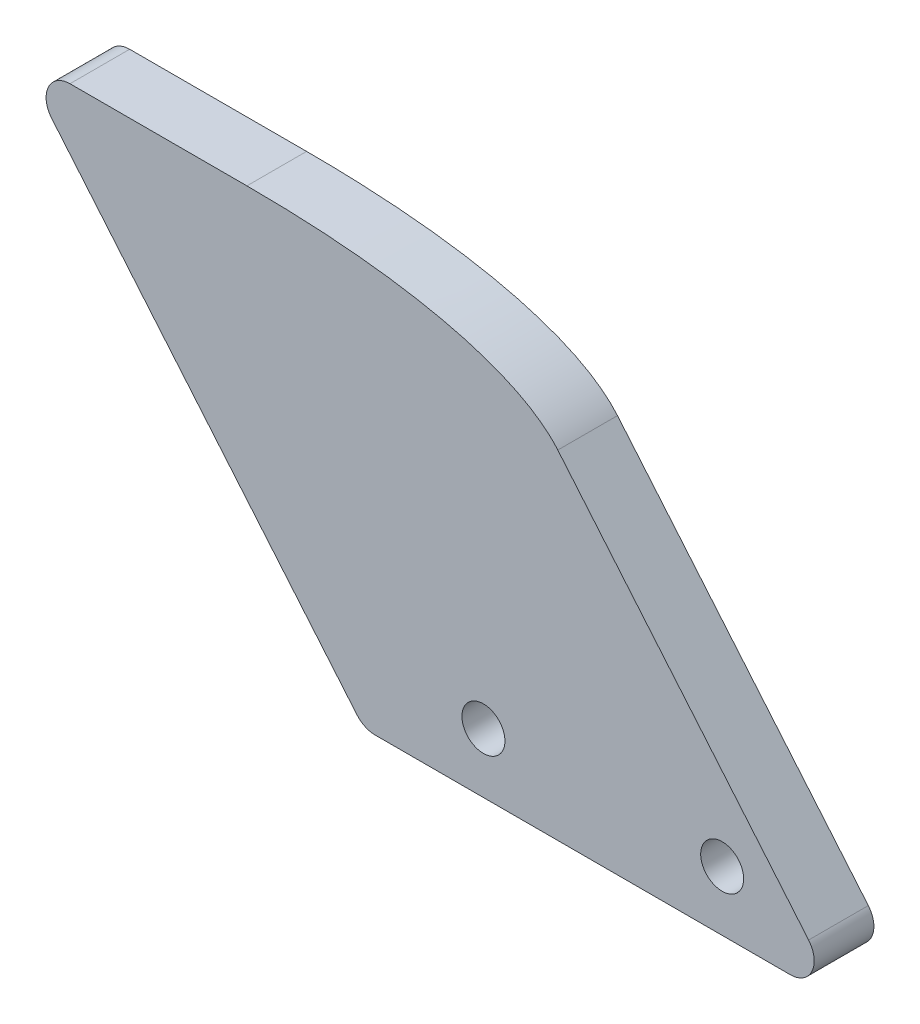
from build123d import *

# Parameters (mm, degrees)
BOSS_EXTRUDE1_DEPTH = 6.35
SKETCH2_R           = 2.286
CUT_EXTRUDE1_DEPTH  = 99.078502682
FILLET2_R           = 2.54


with BuildPart() as part:
    # Sketch1 → Boss-Extrude1 (new body)
    with BuildSketch(Plane.XY):
        Polygon((0, 0), (50.8, 0), (87.535311894, -43.779439924), (36.735311894, -43.779439924), align=None)
    extrude(amount=BOSS_EXTRUDE1_DEPTH)

    # Sketch2 → Cut-Extrude1 (cut, through all)
    with BuildSketch(Plane.XY.offset(6.35)):
        with Locations((74.835311894, -37.429439924)):
            Circle(SKETCH2_R)
        with Locations((49.435311894, -37.429439924)):
            Circle(SKETCH2_R)
    extrude(amount=-CUT_EXTRUDE1_DEPTH, mode=Mode.SUBTRACT)

    # Fillet1
    # an asymmetric fillet: 43.18, 35.56 mm, written as the material it takes off along each edge
    with BuildSketch(Plane(origin=(50.8, 0, -66.322759672), x_dir=(-1, 0, 0), z_dir=(0, 0, 1))) as fillet1_piece_1:
        with BuildLine():
            Bezier((26.529103869, 0), (0, 0), (-6.548695185, 7.804431014), weights=[1, 0.906307787, 1])
            Line((-6.548695185, 7.804431014), (0, 0))
            Line((0, 0), (26.529103869, 0))
        make_face()
    extrude(amount=138.995519344, mode=Mode.SUBTRACT)

    # Fillet2
    fillet2_edges = [part.edges().sort_by_distance(p)[0] for p in [
        (87.535311894, -43.779439924, 3.175),
        (0, 0, 3.175),
        (36.735311894, -43.779439924, 3.175),
    ]]
    fillet(fillet2_edges, radius=FILLET2_R)


solid = part.part
